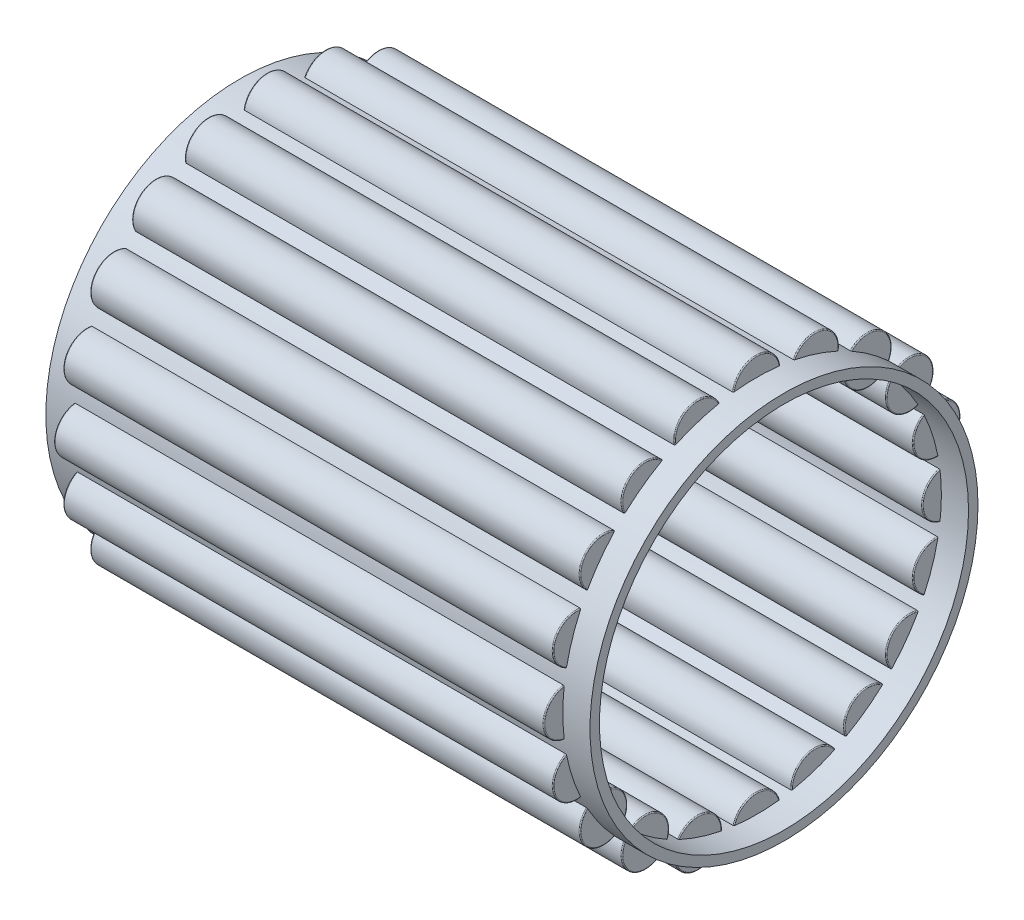
from build123d import *

# Parameters (mm, degrees)
CAGSPISKE_W           = 23
CAGSPISKE_H           = 0.4
ROLLERSDETAILED_COUNT = 20
ROLLERSDETAILED_ANGLE = 342


with BuildPart() as part:
    # CagSpiSke → CageSpine (revolve)
    with BuildSketch(Plane.XY):
        with Locations((0, 8)):
            Rectangle(CAGSPISKE_W, CAGSPISKE_H)
    revolve(axis=Axis((-12.7, 0, 0), (1, 0, 0)))

    # RolDetSke → RollerDetailed (revolve)
    with BuildSketch(Plane.XY):
        with BuildLine():
            Line((-10.31, 9), (10.31, 9))
            ThreePointArc((10.31, 9), (10.338284271, 8.988284271), (10.35, 8.96))
            Line((10.35, 8.96), (10.35, 8))
            Line((10.35, 8), (-10.35, 8))
            Line((-10.35, 8), (-10.35, 8.96))
            ThreePointArc((-10.35, 8.96), (-10.338284271, 8.988284271), (-10.31, 9))
        make_face()
    rollerdetailed = revolve(axis=Axis((-17.78, 8, 0), (1, 0, 0)))

    # RollersDetailed: RollerDetailed ×20 about axis
    rollersdetailed_axis = Axis((-50, 0, 0), (1, 0, 0))
    for i in range(1, ROLLERSDETAILED_COUNT):
        add(rollerdetailed.rotate(rollersdetailed_axis, i * ROLLERSDETAILED_ANGLE / (ROLLERSDETAILED_COUNT - 1)))


solid = part.part
